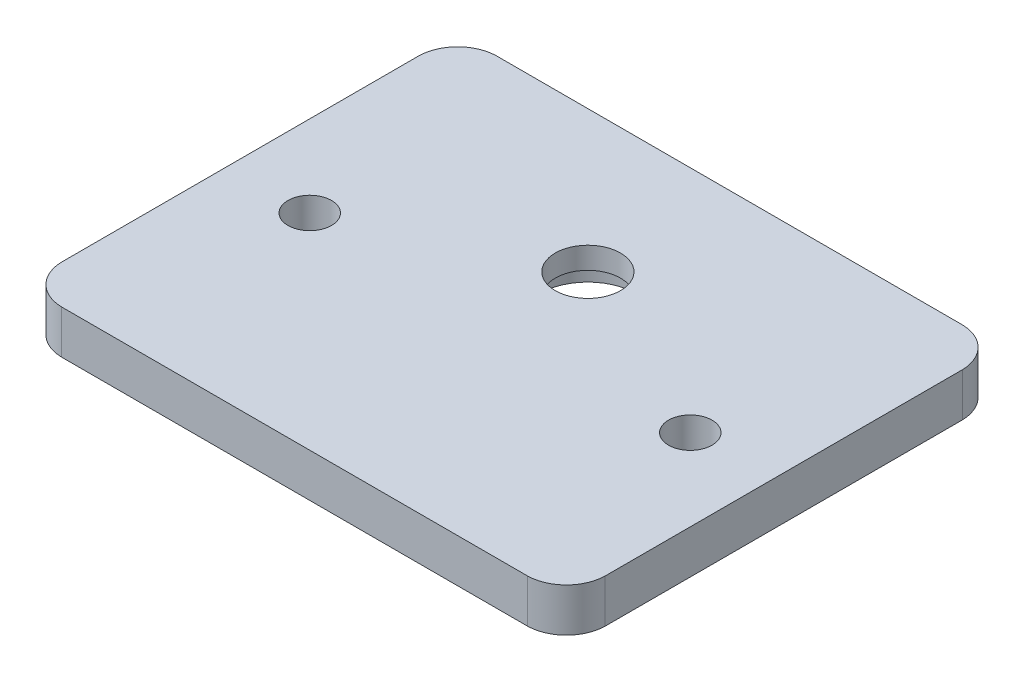
from build123d import *

# Parameters (mm, degrees)
SKETCH1_R           = 2
BOSS_EXTRUDE2_DEPTH = 4
SKETCH1_14_R        = 3
CUT_EXTRUDE2_DEPTH  = 33.26453161
SKETCH1_15_R        = 4.5
CUT_EXTRUDE3_DEPTH  = 2


with BuildPart() as part:
    # Sketch1 → Boss-Extrude2 (new body)
    with BuildSketch(Plane(origin=(0, 0, 0), x_dir=(1, 0, 0), z_dir=(0, 1, 0))):
        with BuildLine():
            Line((21.446973136, 20), (-21.446973136, 20))
            ThreePointArc((-21.446973136, 20), (-23.935145745, 18.935145745), (-25, 16.446973136))
            Line((-25, 16.446973136), (-25, -16.446973136))
            ThreePointArc((-25, -16.446973136), (-23.935145745, -18.935145745), (-21.446973136, -20))
            Line((-21.446973136, -20), (21.446973136, -20))
            ThreePointArc((21.446973136, -20), (23.935145745, -18.935145745), (25, -16.446973136))
            Line((25, -16.446973136), (25, 16.446973136))
            ThreePointArc((25, 16.446973136), (23.935145745, 18.935145745), (21.446973136, 20))
        make_face()
        with Locations((-17.5, -1.102660735)):
            Circle(SKETCH1_R, mode=Mode.SUBTRACT)
        with Locations((17.5, -1.102660735)):
            Circle(SKETCH1_R, mode=Mode.SUBTRACT)
    extrude(amount=BOSS_EXTRUDE2_DEPTH)

    # Sketch1<14> → Cut-Extrude2 (cut, through all)
    with BuildSketch(Plane(origin=(0, 0, 0), x_dir=(1, 0, 0), z_dir=(0, 1, 0))):
        with Locations((-0.021660512, 6.999882702)):
            Circle(SKETCH1_14_R)
    extrude(amount=CUT_EXTRUDE2_DEPTH, mode=Mode.SUBTRACT)

    # Sketch1<15> → Cut-Extrude3 (cut)
    with BuildSketch(Plane(origin=(0, 0, 0), x_dir=(1, 0, 0), z_dir=(0, 1, 0))):
        with Locations((-0.021660512, 6.999882702)):
            Circle(SKETCH1_15_R)
    extrude(amount=CUT_EXTRUDE3_DEPTH, mode=Mode.SUBTRACT)


solid = part.part
